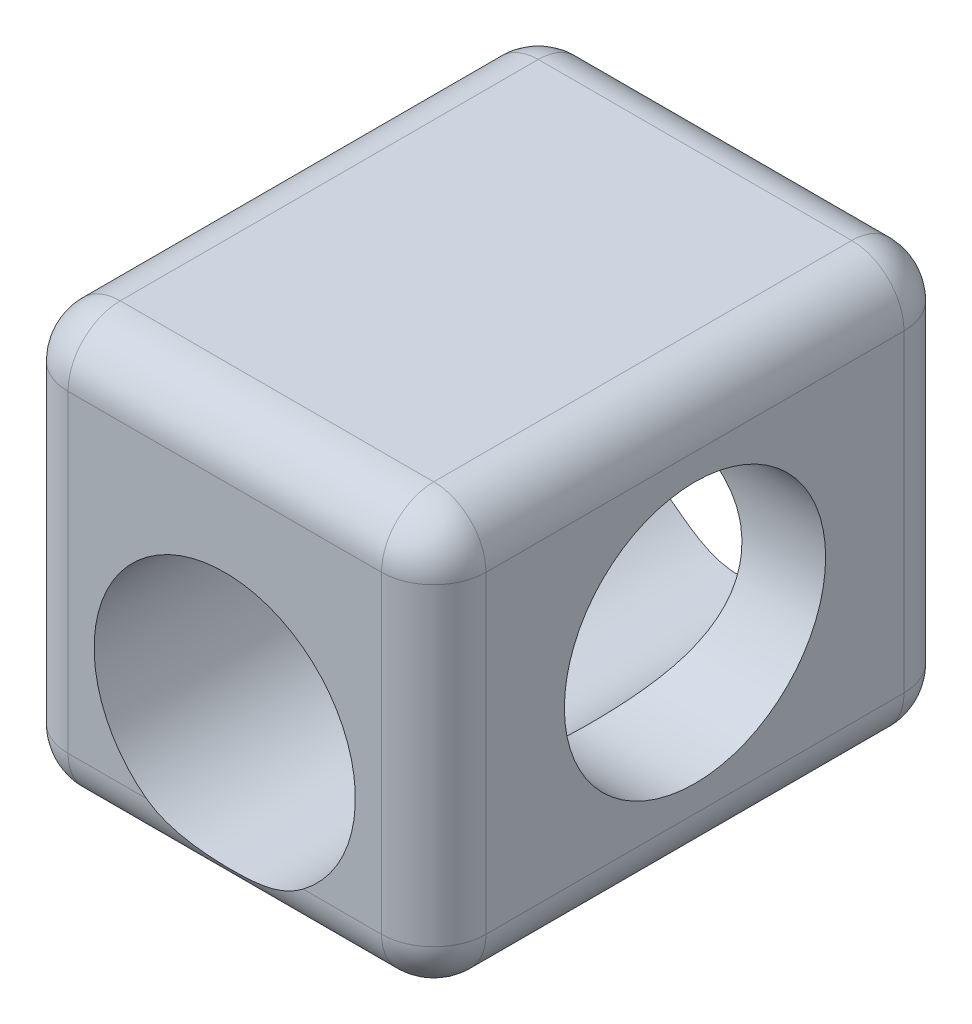
from build123d import *

# Parameters (mm, degrees)
SKETCH_1_W          = 8
SKETCH_1_H          = 8
EXTRUDE_1_DEPTH     = 10
SKETCH_2_R          = 2.5
CUT_EXTRUDE_1_DEPTH = 16.099668871
SKETCH_4_R          = 2.5
CUT_EXTRUDE_2_DEPTH = 16.099668871
FILLET_1_R          = 1


with BuildPart() as part:
    # 草图1 → 凸台-拉伸1 (new body)
    with BuildSketch(Plane.XY):
        with Locations((4, 4)):
            Rectangle(SKETCH_1_W, SKETCH_1_H)
    extrude(amount=EXTRUDE_1_DEPTH)

    # 草图2 → 切除-拉伸1 (cut, through all)
    with BuildSketch(Plane.XY.offset(10)):
        with Locations((4, 3)):
            Circle(SKETCH_2_R)
    extrude(amount=-CUT_EXTRUDE_1_DEPTH, mode=Mode.SUBTRACT)

    # 草图4 → 切除-拉伸2 (cut, through all)
    with BuildSketch(Plane(origin=(8, 0, 0), x_dir=(0, 0, -1), z_dir=(1, 0, 0))):
        with Locations((-5, 4)):
            Circle(SKETCH_4_R)
    extrude(amount=-CUT_EXTRUDE_2_DEPTH, mode=Mode.SUBTRACT)

    # 圆角1
    # the kernel refuses this fillet: 1 mm, written as the material it takes off along each edge
    with BuildSketch(Plane(origin=(7, 7, 9), x_dir=(1, 0, 0), z_dir=(0, 1, 0))) as fillet_1_piece_1_section:
        Polygon((0, 0), (FILLET_1_R, 0), (FILLET_1_R, -FILLET_1_R), (0, -FILLET_1_R), align=None)
    fillet_1_piece_1 = extrude(amount=FILLET_1_R, mode=Mode.PRIVATE)
    fillet_1_piece_1 = fillet_1_piece_1 - Plane(origin=(7, 7, 9), x_dir=(-0.7071067811865475, 0, -0.7071067811865475), z_dir=(0, 1, 0)) * Sphere(FILLET_1_R, mode=Mode.PRIVATE)
    add(fillet_1_piece_1, mode=Mode.SUBTRACT)
    with BuildSketch(Plane(origin=(7, 1, 9), x_dir=(0, 0, 1), z_dir=(1, 0, 0))) as fillet_1_piece_2_section:
        Polygon((0, 0), (FILLET_1_R, 0), (FILLET_1_R, FILLET_1_R), (0, FILLET_1_R), align=None)
    fillet_1_piece_2 = extrude(amount=FILLET_1_R, mode=Mode.PRIVATE)
    fillet_1_piece_2 = fillet_1_piece_2 - Plane(origin=(7, 1, 9), x_dir=(0, 0.7071067811865475, -0.7071067811865475), z_dir=(1, 0, 0)) * Sphere(FILLET_1_R, mode=Mode.PRIVATE)
    add(fillet_1_piece_2, mode=Mode.SUBTRACT)
    with BuildSketch(Plane(origin=(1, 7, 9), x_dir=(-1, 0, 0), z_dir=(0, 1, 0))) as fillet_1_piece_3_section:
        Polygon((0, 0), (FILLET_1_R, 0), (FILLET_1_R, FILLET_1_R), (0, FILLET_1_R), align=None)
    fillet_1_piece_3 = extrude(amount=FILLET_1_R, mode=Mode.PRIVATE)
    fillet_1_piece_3 = fillet_1_piece_3 - Plane(origin=(1, 7, 9), x_dir=(0.7071067811865475, 0, -0.7071067811865475), z_dir=(0, 1, 0)) * Sphere(FILLET_1_R, mode=Mode.PRIVATE)
    add(fillet_1_piece_3, mode=Mode.SUBTRACT)
    with BuildSketch(Plane(origin=(1, 1, 9), x_dir=(0, 0, 1), z_dir=(-1, 0, 0))) as fillet_1_piece_4_section:
        Polygon((0, 0), (FILLET_1_R, 0), (FILLET_1_R, -FILLET_1_R), (0, -FILLET_1_R), align=None)
    fillet_1_piece_4 = extrude(amount=FILLET_1_R, mode=Mode.PRIVATE)
    fillet_1_piece_4 = fillet_1_piece_4 - Plane(origin=(1, 1, 9), x_dir=(0, 0.7071067811865475, -0.7071067811865475), z_dir=(-1, 0, 0)) * Sphere(FILLET_1_R, mode=Mode.PRIVATE)
    add(fillet_1_piece_4, mode=Mode.SUBTRACT)
    with BuildSketch(Plane(origin=(1, 7, 1), x_dir=(-1, 0, 0), z_dir=(0, 1, 0))) as fillet_1_piece_5_section:
        Polygon((0, 0), (FILLET_1_R, 0), (FILLET_1_R, -FILLET_1_R), (0, -FILLET_1_R), align=None)
    fillet_1_piece_5 = extrude(amount=FILLET_1_R, mode=Mode.PRIVATE)
    fillet_1_piece_5 = fillet_1_piece_5 - Plane(origin=(1, 7, 1), x_dir=(0.7071067811865475, 0, 0.7071067811865475), z_dir=(0, 1, 0)) * Sphere(FILLET_1_R, mode=Mode.PRIVATE)
    add(fillet_1_piece_5, mode=Mode.SUBTRACT)
    with BuildSketch(Plane(origin=(7, 7, 1), x_dir=(1, 0, 0), z_dir=(0, 1, 0))) as fillet_1_piece_6_section:
        Polygon((0, 0), (FILLET_1_R, 0), (FILLET_1_R, FILLET_1_R), (0, FILLET_1_R), align=None)
    fillet_1_piece_6 = extrude(amount=FILLET_1_R, mode=Mode.PRIVATE)
    fillet_1_piece_6 = fillet_1_piece_6 - Plane(origin=(7, 7, 1), x_dir=(-0.7071067811865475, 0, 0.7071067811865475), z_dir=(0, 1, 0)) * Sphere(FILLET_1_R, mode=Mode.PRIVATE)
    add(fillet_1_piece_6, mode=Mode.SUBTRACT)
    with BuildSketch(Plane(origin=(7, 1, 1), x_dir=(0, 0, -1), z_dir=(1, 0, 0))) as fillet_1_piece_7_section:
        Polygon((0, 0), (FILLET_1_R, 0), (FILLET_1_R, -FILLET_1_R), (0, -FILLET_1_R), align=None)
    fillet_1_piece_7 = extrude(amount=FILLET_1_R, mode=Mode.PRIVATE)
    fillet_1_piece_7 = fillet_1_piece_7 - Plane(origin=(7, 1, 1), x_dir=(0, 0.7071067811865475, 0.7071067811865475), z_dir=(1, 0, 0)) * Sphere(FILLET_1_R, mode=Mode.PRIVATE)
    add(fillet_1_piece_7, mode=Mode.SUBTRACT)
    with BuildSketch(Plane(origin=(1, 1, 1), x_dir=(0, 0, -1), z_dir=(-1, 0, 0))) as fillet_1_piece_8_section:
        Polygon((0, 0), (FILLET_1_R, 0), (FILLET_1_R, FILLET_1_R), (0, FILLET_1_R), align=None)
    fillet_1_piece_8 = extrude(amount=FILLET_1_R, mode=Mode.PRIVATE)
    fillet_1_piece_8 = fillet_1_piece_8 - Plane(origin=(1, 1, 1), x_dir=(0, 0.7071067811865475, 0.7071067811865475), z_dir=(-1, 0, 0)) * Sphere(FILLET_1_R, mode=Mode.PRIVATE)
    add(fillet_1_piece_8, mode=Mode.SUBTRACT)
    with BuildSketch(Plane(origin=(8, 7, 10), x_dir=(0, 0, -1), z_dir=(0, -1, 0)), Plane(origin=(1, 8, 10), x_dir=(0, 0, -1), z_dir=(1, 0, 0)), Plane(origin=(0, 1, 10), x_dir=(0, 0, -1), z_dir=(0, 1, 0)), Plane(origin=(7, 0, 0), x_dir=(0, 1, 0), z_dir=(-1, 0, 0))) as fillet_1_piece_9:
        with BuildLine():
            CenterArc((FILLET_1_R, -FILLET_1_R), FILLET_1_R, 90, 90)
            Line((0, -FILLET_1_R), (0, 0))
            Line((0, 0), (FILLET_1_R, 0))
        make_face()
    extrude(amount=6, mode=Mode.SUBTRACT)
    with BuildSketch(Plane(origin=(1, 8, 0), x_dir=(0, 0, 1), z_dir=(1, 0, 0)), Plane(origin=(8, 7, 0), x_dir=(0, 0, 1), z_dir=(0, -1, 0)), Plane(origin=(0, 1, 0), x_dir=(0, 0, 1), z_dir=(0, 1, 0)), Plane(origin=(7, 0, 10), x_dir=(0, 1, 0), z_dir=(-1, 0, 0))) as fillet_1_piece_10:
        with BuildLine():
            CenterArc((FILLET_1_R, FILLET_1_R), FILLET_1_R, 180, 90)
            Line((0, FILLET_1_R), (0, 0))
            Line((0, 0), (FILLET_1_R, 0))
        make_face()
    extrude(amount=6, mode=Mode.SUBTRACT)
    with BuildSketch(Plane(origin=(0, 8, 1), x_dir=(1, 0, 0), z_dir=(0, 0, 1)), Plane(origin=(0, 0, 1), x_dir=(0, 1, 0), z_dir=(0, 0, 1))) as fillet_1_piece_11:
        with BuildLine():
            CenterArc((FILLET_1_R, -FILLET_1_R), FILLET_1_R, 90, 90)
            Line((0, -FILLET_1_R), (0, 0))
            Line((0, 0), (FILLET_1_R, 0))
        make_face()
    extrude(amount=8, mode=Mode.SUBTRACT)
    with BuildSketch(Plane(origin=(8, 8, 1), x_dir=(-1, 0, 0), z_dir=(0, 0, 1)), Plane(origin=(8, 0, 1), x_dir=(0, 1, 0), z_dir=(0, 0, 1))) as fillet_1_piece_12:
        with BuildLine():
            CenterArc((FILLET_1_R, FILLET_1_R), FILLET_1_R, 180, 90)
            Line((0, FILLET_1_R), (0, 0))
            Line((0, 0), (FILLET_1_R, 0))
        make_face()
    extrude(amount=8, mode=Mode.SUBTRACT)


solid = part.part
